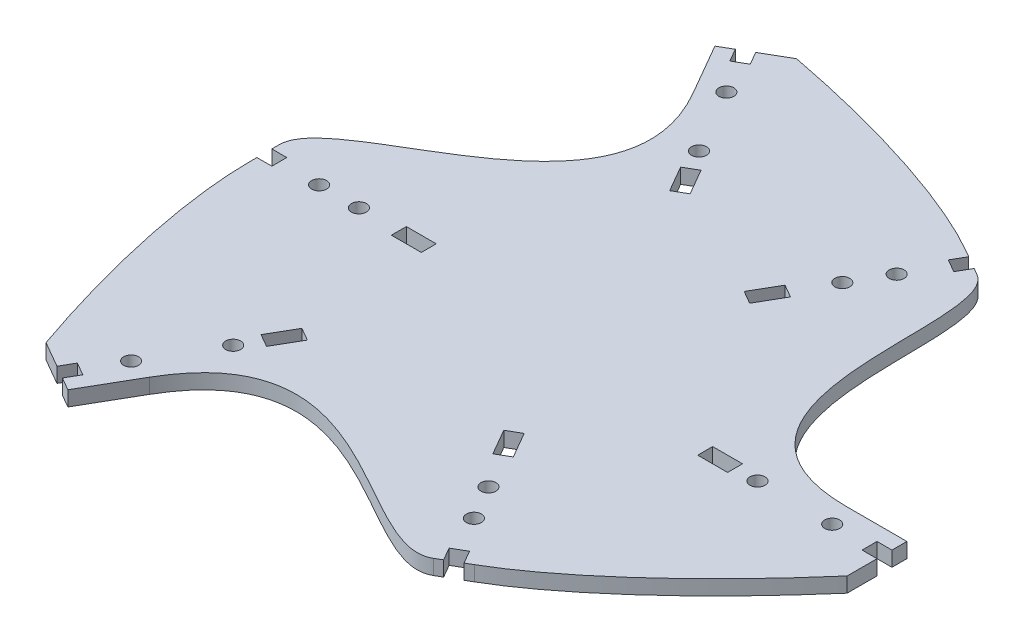
from build123d import *

# Parameters (mm, degrees)
SKETCH1_R           = 1.5875
SKETCH1_R_2         = 1.587500001
SKETCH1_R_3         = 1.587500002
SKETCH1_W           = 6.35
SKETCH1_H           = 3.175
BOSS_EXTRUDE1_DEPTH = 3.175


with BuildPart() as part:
    # Sketch1 → Boss-Extrude1 (new body)
    with BuildSketch(Plane(origin=(0, 0, 0), x_dir=(1, 0, 0), z_dir=(0, 1, 0))):
        with BuildLine():
            Line((-40.849630717, -64.403635733), (-43.599261374, -62.816135733))
            Line((-43.599261374, -62.816135733), (-42.011761374, -60.066505076))
            Line((-42.011761374, -60.066505076), (-44.761392031, -58.479005076))
            Line((-44.761392031, -58.479005076), (-46.348892031, -61.228635733))
            Line((-46.348892031, -61.228635733), (-51.848153345, -58.053635733))
            add(Edge.make_bspline(
                [(-63.499999999, -3.175000002), (-63.499999999, -15.740750771), (-59.650132181, -35.587199818), (-51.848153345, -58.053635733)],
                knots=[0, 0, 0, 0, 1, 1, 1, 1], degree=3))
            Line((-63.499999999, -3.175000002), (-63.499999999, -1.587500002))
            Line((-63.499999999, -1.587500002), (-60.324999999, -1.587500002))
            Line((-60.324999999, -1.587500002), (-60.324999999, 1.587499998))
            Line((-60.324999999, 1.587499998), (-63.499999999, 1.587499998))
            Line((-63.499999999, 1.587499998), (-63.499999999, 3.174999998))
            add(Edge.make_bspline(
                [(-29.000369281, 56.580113174), (-10.28155306, 24.158172423), (-63.499999999, 16.015994265), (-63.499999999, 3.174999998)],
                knots=[0, 0, 0, 0, 1, 1, 1, 1], degree=3))
            Line((-29.000369281, 56.580113174), (-35.350369281, 67.578635802))
            Line((-35.350369281, 67.578635802), (-32.600738624, 69.166135802))
            Line((-32.600738624, 69.166135802), (-31.013238624, 66.416505145))
            Line((-31.013238624, 66.416505145), (-28.263607967, 68.004005145))
            Line((-28.263607967, 68.004005145), (-29.851107967, 70.753635802))
            Line((-29.851107967, 70.753635802), (-24.351846653, 73.928635802))
            add(Edge.make_bspline(
                [(29.000369343, 56.58011314), (18.118109959, 62.862988525), (-0.994353, 69.452129717), (-24.351846653, 73.928635802)],
                knots=[0, 0, 0, 0, 1, 1, 1, 1], degree=3))
            Line((29.000369343, 56.58011314), (30.375184671, 55.786363141))
            Line((30.375184671, 55.786363141), (28.787684671, 53.036732483))
            Line((28.787684671, 53.036732483), (31.537315328, 51.449232484))
            Line((31.537315328, 51.449232484), (33.124815328, 54.198863141))
            Line((33.124815328, 54.198863141), (34.499630657, 53.405113141))
            add(Edge.make_bspline(
                [(63.5, -3.175000071), (26.062367559, -3.175000071), (45.620257902, 46.984616007), (34.499630657, 53.405113141)],
                knots=[0, 0, 0, 0, 1, 1, 1, 1], degree=3))
            Line((63.5, -3.175000071), (76.2, -3.175000071))
            Line((76.2, -3.175000071), (76.2, -6.350000071))
            Line((76.2, -6.350000071), (73.025, -6.350000071))
            Line((73.025, -6.350000071), (73.025, -9.525000071))
            Line((73.025, -9.525000071), (76.2, -9.525000071))
            Line((76.2, -9.525000071), (76.2, -15.875000071))
            add(Edge.make_bspline(
                [(34.499630659, -53.40511314), (45.381890043, -47.122237755), (60.644485183, -33.8649299), (76.2, -15.875000071)],
                knots=[0, 0, 0, 0, 1, 1, 1, 1], degree=3))
            Line((34.499630659, -53.40511314), (33.12481533, -54.19886314))
            Line((33.12481533, -54.19886314), (31.53731533, -51.449232483))
            Line((31.53731533, -51.449232483), (28.787684673, -53.036732483))
            Line((28.787684673, -53.036732483), (30.375184673, -55.78636314))
            Line((30.375184673, -55.78636314), (29.000369345, -56.58011314))
            add(Edge.make_bspline(
                [(-34.499630717, -53.405113105), (-15.780814496, -20.983172353), (17.8797421, -63.000610273), (29.000369345, -56.58011314)],
                knots=[0, 0, 0, 0, 1, 1, 1, 1], degree=3))
            Line((-34.499630717, -53.405113105), (-40.849630717, -64.403635733))
        make_face()
        with Locations((65.0875, -7.937500071)):
            Circle(SKETCH1_R, mode=Mode.SUBTRACT)
        with Locations((49.2125, -7.937500071)):
            Circle(SKETCH1_R, mode=Mode.SUBTRACT)
        with Locations((25.9334, 44.917966413)):
            Circle(SKETCH1_R, mode=Mode.SUBTRACT)
        with Locations((21.704299999, 37.592950343)):
            Circle(SKETCH1_R_2, mode=Mode.SUBTRACT)
        with Locations((-39.417826702, -52.398678433)):
            Circle(SKETCH1_R, mode=Mode.SUBTRACT)
        with Locations((-31.480326702, -38.650525148)):
            Circle(SKETCH1_R, mode=Mode.SUBTRACT)
        with Locations((25.933400002, -44.917966413)):
            Circle(SKETCH1_R_2, mode=Mode.SUBTRACT)
        with Locations((21.704300002, -37.592950343)):
            Circle(SKETCH1_R_2, mode=Mode.SUBTRACT)
        with Locations((-25.669673295, 60.336178503)):
            Circle(SKETCH1_R_2, mode=Mode.SUBTRACT)
        with Locations((-17.732173295, 46.588025218)):
            Circle(SKETCH1_R_2, mode=Mode.SUBTRACT)
        with Locations((-51.866799999, -2e-09)):
            Circle(SKETCH1_R_3, mode=Mode.SUBTRACT)
        with Locations((-43.408599999, -2e-09)):
            Circle(SKETCH1_R_3, mode=Mode.SUBTRACT)
        Polygon((15.662315329, 23.952925913), (18.837315329, 29.452187227), (16.087684672, 31.039687227), (12.912684672, 25.540425913), align=None, mode=Mode.SUBTRACT)
        with Locations((41.275, -7.937500071)):
            Rectangle(SKETCH1_W, SKETCH1_H, mode=Mode.SUBTRACT)
        Polygon((12.912684673, -25.540425913), (16.087684673, -31.039687227), (18.83731533, -29.452187227), (15.66231533, -23.952925913), align=None, mode=Mode.SUBTRACT)
        Polygon((-24.549261374, -29.820567849), (-27.724261374, -35.319829163), (-30.473892031, -33.732329163), (-27.298892031, -28.233067849), align=None, mode=Mode.SUBTRACT)
        with Locations((-31.749999999, -1e-09)):
            Rectangle(SKETCH1_W, SKETCH1_H, mode=Mode.SUBTRACT)
        Polygon((-13.550738624, 36.170567918), (-16.725738624, 41.669829232), (-13.976107967, 43.257329232), (-10.801107967, 37.758067918), align=None, mode=Mode.SUBTRACT)
    extrude(amount=BOSS_EXTRUDE1_DEPTH)


solid = part.part
